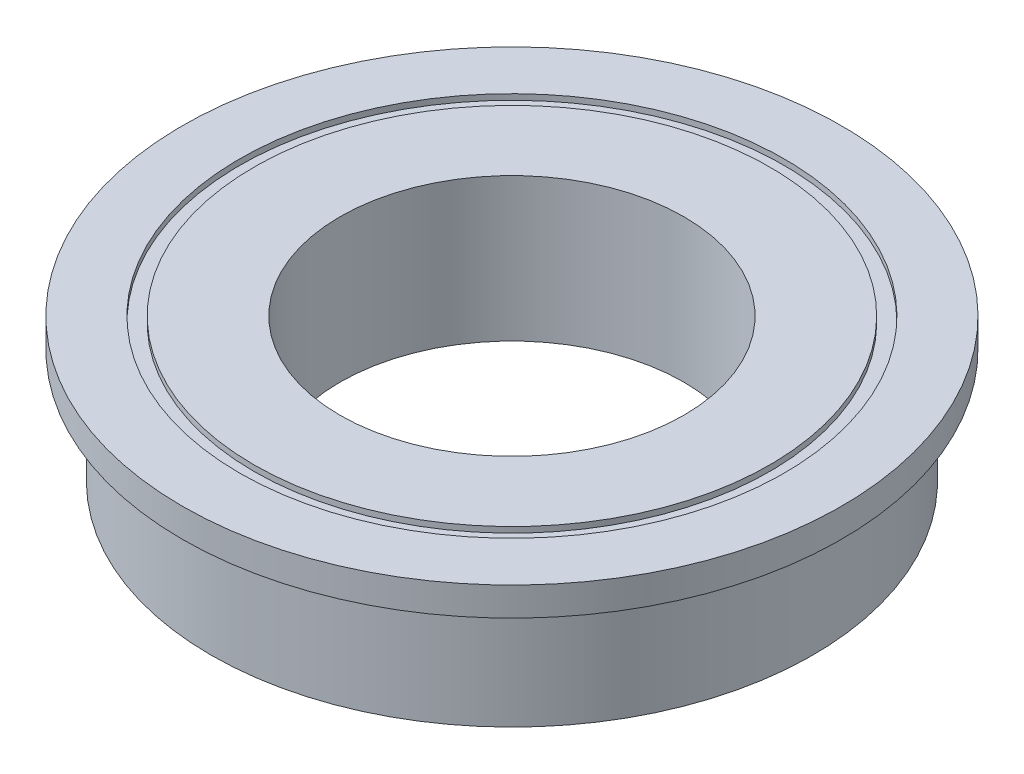
from build123d import *

# Parameters (mm, degrees)
SKETCH_1_R          = 10.5
SKETCH_1_R_2        = 6
EXTRUDE_1_DEPTH     = 4
SKETCH_2_R          = 11.5
SKETCH_2_R_2        = 6
EXTRUDE_2_DEPTH     = 1
SKETCH_3_R          = 9.5
SKETCH_3_R_2        = 9
CUT_EXTRUDE_1_DEPTH = 0.2
CUT_EXTRUDE_START   = -0.2
SKETCH_4_R          = 9.5
SKETCH_4_R_2        = 9
CUT_EXTRUDE_2_DEPTH = 0.2


with BuildPart() as part:
    # 草图1 → 凸台-拉伸1 (new body)
    with BuildSketch(Plane(origin=(0, 0, 0), x_dir=(1, 0, 0), z_dir=(0, 1, 0))):
        Circle(SKETCH_1_R)
        Circle(SKETCH_1_R_2, mode=Mode.SUBTRACT)
    extrude(amount=EXTRUDE_1_DEPTH)

    # 草图2 → 凸台-拉伸2 (add)
    with BuildSketch(Plane(origin=(0, 4, 0), x_dir=(1, 0, 0), z_dir=(0, 1, 0))):
        Circle(SKETCH_2_R)
        Circle(SKETCH_2_R_2, mode=Mode.SUBTRACT)
    extrude(amount=EXTRUDE_2_DEPTH)

    # 草图3 → 切除-拉伸1 (cut)
    with BuildSketch(Plane.XZ):
        Circle(SKETCH_3_R)
        Circle(SKETCH_3_R_2, mode=Mode.SUBTRACT)
    extrude(amount=-CUT_EXTRUDE_1_DEPTH, mode=Mode.SUBTRACT)

    # 草图4 → 切除-拉伸2 (cut)
    with BuildSketch(Plane(origin=(0, 5, 0), x_dir=(1, 0, 0), z_dir=(0, 1, 0)).offset(CUT_EXTRUDE_START)):
        Circle(SKETCH_4_R)
        Circle(SKETCH_4_R_2, mode=Mode.SUBTRACT)
    extrude(amount=CUT_EXTRUDE_2_DEPTH, mode=Mode.SUBTRACT)


solid = part.part
